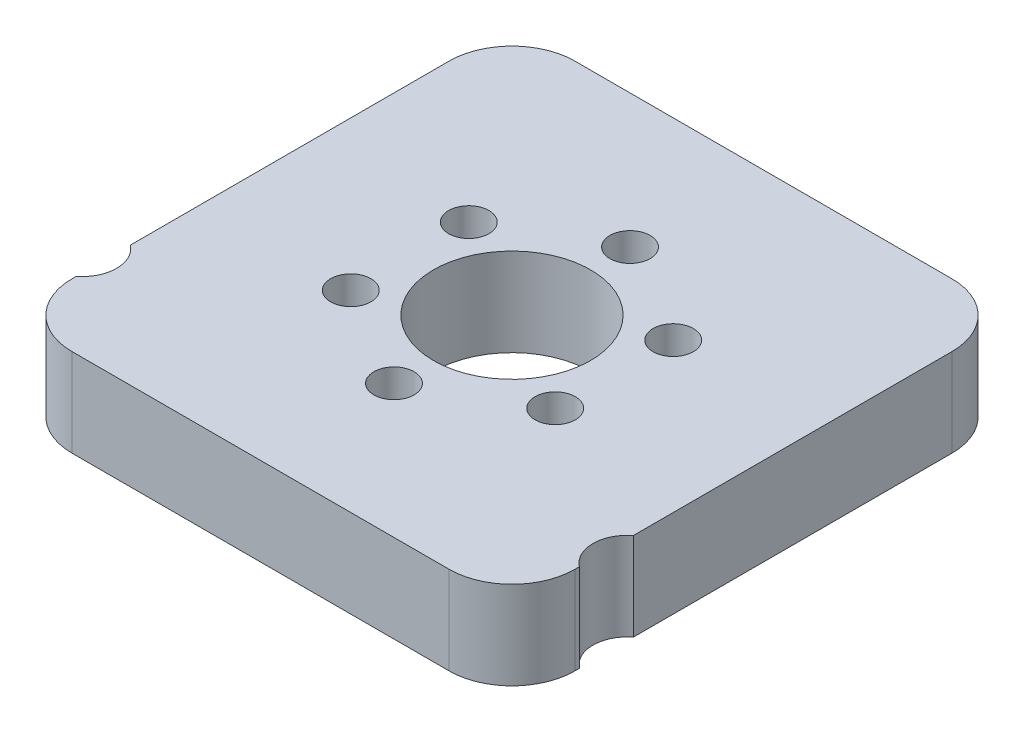
from build123d import *

# Parameters (mm, degrees)
SKETCH1_R           = 6.25
BOSS_EXTRUDE1_DEPTH = 7
SKETCH6_R           = 1.6
CUT_EXTRUDE1_DEPTH  = 30.137604569
FILLET2_R           = 5


with BuildPart() as part:
    # Sketch1 → Boss-Extrude1 (new body)
    with BuildSketch(Plane(origin=(0, 0, 0), x_dir=(1, 0, 0), z_dir=(0, 1, 0))):
        with BuildLine():
            Line((-20, -14.645854519), (-20, -20))
            Line((-20, -20), (20, -20))
            Line((20, -20), (20, -14.645854519))
            ThreePointArc((20, -14.645854519), (18.943369346, -12.5), (20, -10.354145481))
            Line((20, -10.354145481), (20, 20))
            Line((20, 20), (-20, 20))
            Line((-20, 20), (-20, -10.354145481))
            ThreePointArc((-20, -10.354145481), (-19.221849833, -11.304052681), (-18.943369346, -12.5))
            ThreePointArc((-18.943369346, -12.5), (-19.221849833, -13.695947319), (-20, -14.645854519))
        make_face()
        Circle(SKETCH1_R, mode=Mode.SUBTRACT)
    extrude(amount=BOSS_EXTRUDE1_DEPTH)

    # Sketch6 → Cut-Extrude1 (cut, through all)
    with BuildSketch(Plane(origin=(0, 7, 0), x_dir=(1, 0, 0), z_dir=(0, 1, 0))):
        with Locations((0, -9.385)):
            Circle(SKETCH6_R)
        with Locations((-8.127648415, -4.6925)):
            Circle(SKETCH6_R)
        with Locations((-8.127648415, 4.6925)):
            Circle(SKETCH6_R)
        with Locations((0, 9.385)):
            Circle(SKETCH6_R)
        with Locations((8.127648415, 4.6925)):
            Circle(SKETCH6_R)
        with Locations((8.127648415, -4.6925)):
            Circle(SKETCH6_R)
    extrude(amount=-CUT_EXTRUDE1_DEPTH, mode=Mode.SUBTRACT)

    # Fillet2
    fillet2_edges = [part.edges().sort_by_distance(p)[0] for p in [
        (20, 3.5, 20),
        (20, 3.5, -20),
        (-20, 3.5, -20),
        (-20, 3.5, 20),
    ]]
    fillet(fillet2_edges, radius=FILLET2_R)


solid = part.part
